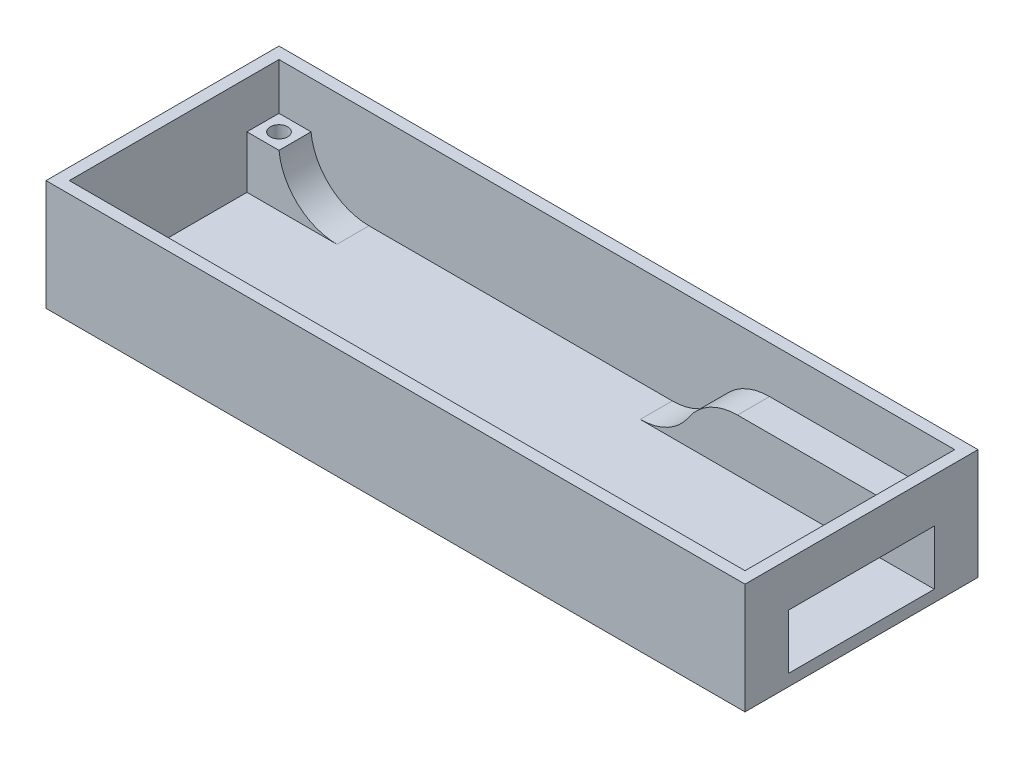
from build123d import *

# Parameters (mm, degrees)
SKETCH1_W           = 60
SKETCH1_H           = 20
BOSS_EXTRUDE1_DEPTH = 9.5
SHELL1_T            = -1
SKETCH2_W           = 12.5
SKETCH2_H           = 4.7
CUT_EXTRUDE1_DEPTH  = 12
SKETCH3_W           = 19.267308131
SKETCH3_H           = 2.75
SKETCH3_R           = 0.75
SKETCH3_W_2         = 2.75
BOSS_EXTRUDE2_DEPTH = 4.5
FILLET1_R           = 5
FILLET2_R           = 5


with BuildPart() as part:
    # Sketch1 → Boss-Extrude1 (new body)
    with BuildSketch(Plane(origin=(0, 0, 0), x_dir=(1, 0, 0), z_dir=(0, 1, 0))):
        Rectangle(SKETCH1_W, SKETCH1_H)
    extrude(amount=BOSS_EXTRUDE1_DEPTH)

    # Shell1
    shell1_openings = [part.faces().sort_by_distance(p)[0] for p in [
        (0, 9.5, 0),
    ]]
    offset(amount=SHELL1_T, openings=shell1_openings, kind=Kind.INTERSECTION)

    # Sketch2 → Cut-Extrude1 (cut)
    with BuildSketch(Plane(origin=(30, 0, 0), x_dir=(0, 0, -1), z_dir=(1, 0, 0))):
        with Locations((0, 3.35)):
            Rectangle(SKETCH2_W, SKETCH2_H)
    extrude(amount=-CUT_EXTRUDE1_DEPTH, mode=Mode.SUBTRACT)

    # Sketch3 → Boss-Extrude2 (add)
    # profile 1 of 4: a face of its own
    with BuildSketch(Plane(origin=(0, 1, 0), x_dir=(1, 0, 0), z_dir=(0, 1, 0))):
        with Locations((19.366345935, 7.625)):
            Rectangle(SKETCH3_W, SKETCH3_H)
        with Locations(Location((26.5, 7.625, 0), (0, 0, 270))):
            Circle(SKETCH3_R, mode=Mode.SUBTRACT)
    # profile 2 of 4: a face of its own
    with BuildSketch(Plane(origin=(0, 1, 0), x_dir=(1, 0, 0), z_dir=(0, 1, 0))):
        with Locations((-27.625, 7.625)):
            Rectangle(SKETCH3_W_2, SKETCH3_H)
        with Locations(Location((-27.625, 7.625, 0), (0, 0, 270))):
            Circle(SKETCH3_R, mode=Mode.SUBTRACT)
    # profile 3 of 4: a face of its own
    with BuildSketch(Plane(origin=(0, 1, 0), x_dir=(1, 0, 0), z_dir=(0, 1, 0))):
        with Locations((-27.625, -7.625)):
            Rectangle(SKETCH3_W_2, SKETCH3_H)
        with Locations(Location((-27.625, -7.625, 0), (0, 0, 90))):
            Circle(SKETCH3_R, mode=Mode.SUBTRACT)
    # profile 4 of 4: a face of its own
    with BuildSketch(Plane(origin=(0, 1, 0), x_dir=(1, 0, 0), z_dir=(0, 1, 0))):
        with Locations((19.366345935, -7.625)):
            Rectangle(SKETCH3_W, SKETCH3_H)
        with Locations(Location((26.5, -7.625, 0), (0, 0, 90))):
            Circle(SKETCH3_R, mode=Mode.SUBTRACT)
    extrude(amount=BOSS_EXTRUDE2_DEPTH)

    # Fillet1
    # the kernel refuses this fillet: 5 mm, written as the material it adds along each edge
    with BuildSketch(Plane(origin=(-26.25, 1, 9), x_dir=(1, 0, 0), z_dir=(0, 0, -1))) as fillet1_piece_1:
        with BuildLine():
            CenterArc((4.974937186, -5), FILLET1_R, 90, 84.260829523)
            Line((0, -4.5), (-0.099498744, -4.49))
            ThreePointArc((-0.099498744, -4.49), (-0.1, -2.25), (-0.1, 0))
            Line((-0.1, 0), (0, 0.1))
            Line((0, 0.1), (4.974937186, 0.1))
            Line((4.974937186, 0.1), (4.974937186, 0))
        make_face()
    extrude(amount=2.75)
    with BuildSketch(Plane(origin=(-26.25, 1, -9), x_dir=(1, 0, 0), z_dir=(0, 0, 1)), Plane(origin=(9.732691869, 1, 9), x_dir=(-1, 0, 0), z_dir=(0, 0, -1))) as fillet1_piece_2:
        with BuildLine():
            CenterArc((4.974937186, 5), FILLET1_R, 185.739170477, 84.260829523)
            Line((0, 4.5), (-0.099498744, 4.49))
            ThreePointArc((-0.099498744, 4.49), (-0.1, 2.25), (-0.1, 0))
            Line((-0.1, 0), (0, -0.1))
            Line((0, -0.1), (4.974937186, -0.1))
            Line((4.974937186, -0.1), (4.974937186, 0))
        make_face()
    extrude(amount=2.75)
    with BuildSketch(Plane(origin=(9.732691869, 1, -9), x_dir=(0, 1, 0), z_dir=(0, 0, 1))) as fillet1_piece_3:
        with BuildLine():
            CenterArc((5, 4.974937186), FILLET1_R, 180, 84.260829523)
            Line((0, 4.974937186), (-0.1, 4.974937186))
            Line((-0.1, 4.974937186), (-0.1, 0))
            Line((-0.1, 0), (0, -0.1))
            ThreePointArc((0, -0.1), (2.25, -0.1), (4.49, -0.099498744))
            Line((4.49, -0.099498744), (4.5, 0))
        make_face()
    extrude(amount=2.75)

    # Fillet2
    fillet2_edges = [part.edges().sort_by_distance(p)[0] for p in [
        (9.732691869, 5.5, -7.625),
        (9.732691869, 5.5, 7.625),
    ]]
    fillet(fillet2_edges, radius=FILLET2_R)


solid = part.part
